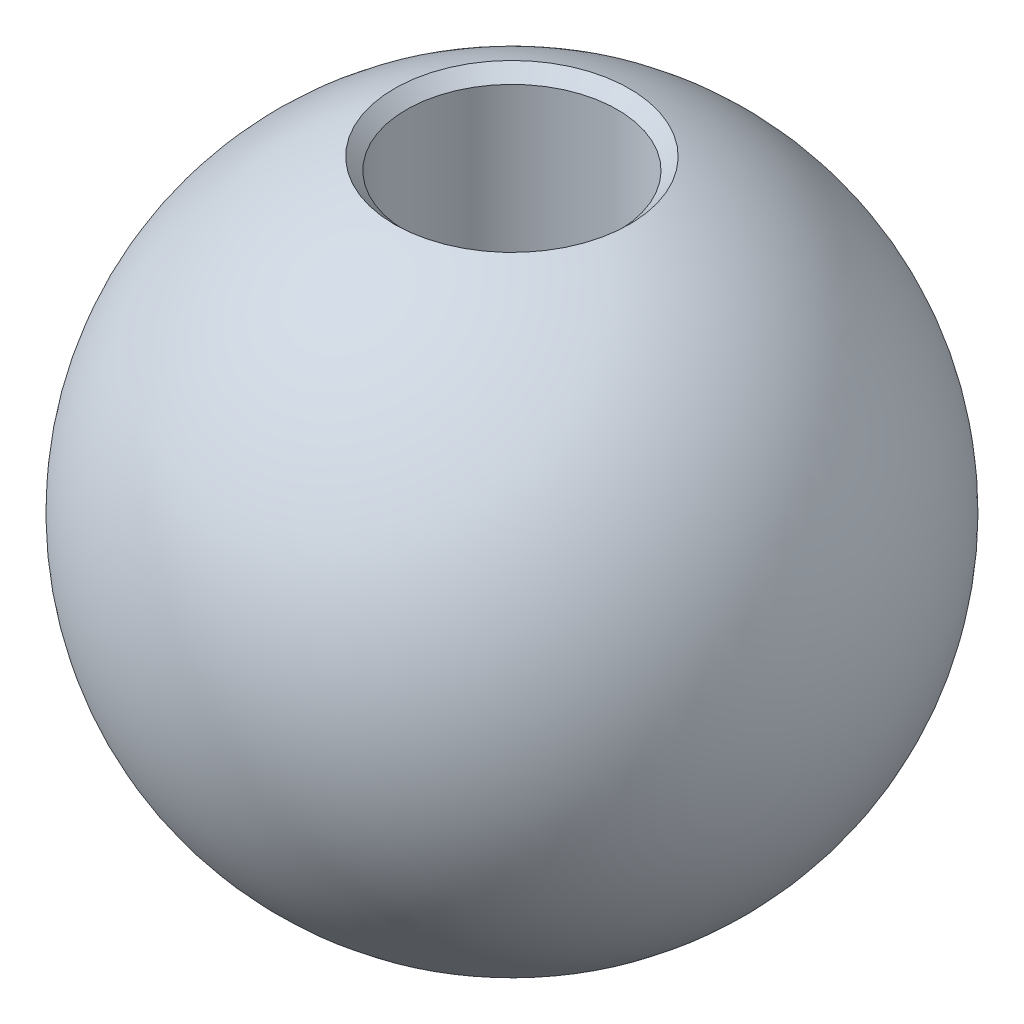
from build123d import *

# Parameters (mm, degrees)
M3_CLEARANCE_HOLE1_D = 3.2
CHAMFER1_SIZE        = 0.25


with BuildPart() as part:
    # Sketch2 → Revolve1 (revolve)
    with BuildSketch(Plane.XY):
        with BuildLine():
            Line((-5, 0), (5, 0))
            ThreePointArc((5, 0), (0, 5), (-5, 0))
        make_face()
    revolve(axis=Axis((-5, 0, 0), (1, 0, 0)))

    # M3 Clearance Hole1 (through all)
    with Locations(Plane(origin=(0, 5, 0), x_dir=(1, 0, 0), z_dir=(0, 1, 0))):
        with Locations((0, 0)):
            Hole(M3_CLEARANCE_HOLE1_D / 2)

    # Chamfer1
    # the kernel refuses this chamfer: 0.25, 0.197251491 mm, written as the material it takes off along each edge
    with BuildSketch(Plane(origin=(-3e-09, -4.737087713, 0), x_dir=(-1.0, 0, -1.7241398847038223e-10), z_dir=(-1.7241398847038223e-10, 0, 1.0))) as chamfer1_piece_1:
        with BuildLine():
            Line((1.783867045, -0.066132952), (1.600000003, -0.249999994))
            Line((1.600000003, -0.249999994), (1.599999997, 0))
            ThreePointArc((1.599999997, 0), (1.69425958, -0.032889111), (1.783867045, -0.066132952))
        make_face()
    revolve(axis=Axis((-3e-09, -4.737087713, 0), (0, -1, 0)), mode=Mode.SUBTRACT)
    with BuildSketch(Plane(origin=(0, 4.737087713, 5e-09), x_dir=(-1.0, 0, -2.962106121087604e-09), z_dir=(-2.962106121087604e-09, 0, 1.0))) as chamfer1_piece_2:
        with BuildLine():
            Line((1.783867047, 0.066132952), (1.600000005, 0.249999995))
            Line((1.600000005, 0.249999995), (1.6, 0))
            ThreePointArc((1.6, 0), (1.694259582, 0.032889111), (1.783867047, 0.066132952))
        make_face()
    revolve(axis=Axis((0, 4.737087713, 5e-09), (0, -1, 0)), revolution_arc=179.999999661, mode=Mode.SUBTRACT)
    with BuildSketch(Plane(origin=(0, 4.737087713, 0), x_dir=(1.0, 0, -6.014235446318052e-11), z_dir=(-6.014235446318052e-11, -1.2821909266166277e-15, -1.0))) as chamfer1_piece_3:
        with BuildLine():
            Line((1.783867046, 0.066132954), (1.6, CHAMFER1_SIZE))
            Line((1.6, CHAMFER1_SIZE), (1.6, 0))
            ThreePointArc((1.6, 0), (1.694259582, 0.032889113), (1.783867046, 0.066132954))
        make_face()
    revolve(axis=Axis((0, 4.737087713, 0), (0, -1, 0)), revolution_arc=180.000000007, mode=Mode.SUBTRACT)


solid = part.part
